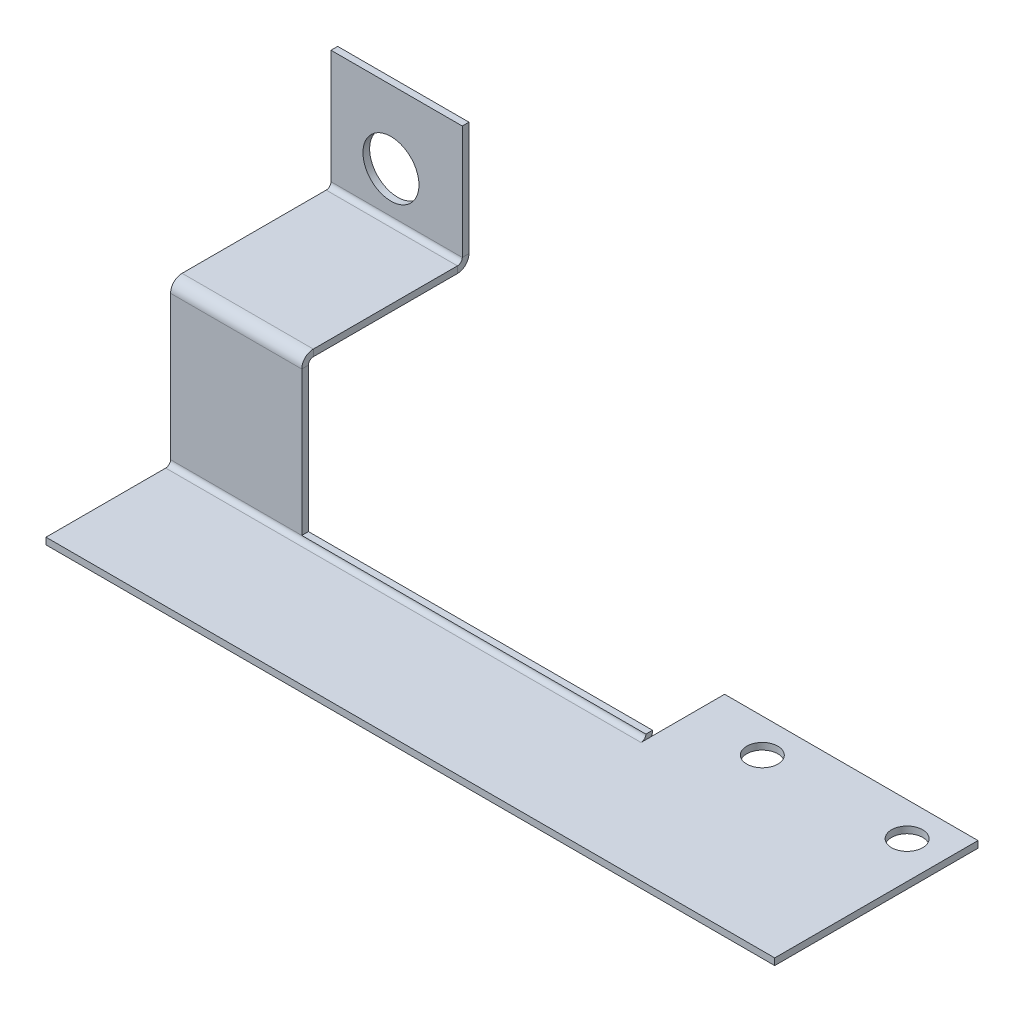
from build123d import *

# Parameters (mm, degrees)
SKETCH1_W                    = 110.7186
SKETCH1_H                    = 19.939
BASE_FLANGE1_DEPTH           = 1.016
EDGE_FLANGE1_STRIP_W         = 5.5372
EDGE_FLANGE1_STRIP_H         = 1.016
EDGE_FLANGE1_STRIP_CUT_DEPTH = 110.7186
EDGE_FLANGE1_DEPTH           = 110.7186
CUT_EXTRUDE1_REACH           = 116.94
SKETCH9_W                    = 90.7796
SKETCH9_H                    = 23.6474
EDGE_FLANGE2_STRIP_W         = 5.5372
EDGE_FLANGE2_STRIP_H         = 1.016
EDGE_FLANGE2_STRIP_CUT_DEPTH = 19.939
EDGE_FLANGE2_DEPTH           = 19.939
EDGE_FLANGE3_STRIP_W         = 5.5372
EDGE_FLANGE3_STRIP_H         = 1.016
EDGE_FLANGE3_STRIP_CUT_DEPTH = 19.939
EDGE_FLANGE3_DEPTH           = 19.939
CUT_EXTRUDE2_DEPTH           = 2.54
CUT_EXTRUDE2_DEPTH_BACK      = 2.54
SKETCH17_W                   = 38.49878
SKETCH17_H                   = 1.7526
SKETCH16_W                   = 38.49878
SKETCH16_H                   = 12.7
TAB2_DEPTH                   = 1.016
CUT_EXTRUDE3_REACH           = 128.228
SKETCH20_R                   = 4.2545
CUT_EXTRUDE4_REACH           = 128.58
SKETCH21_R                   = 2.36295848


# Sheet-metal steps are written as plain solids
with BuildPart() as part:
    # Sketch1 → Base-Flange1 (new body)
    with BuildSketch(Plane(origin=(0, 0, 0), x_dir=(1, 0, 0), z_dir=(0, 1, 0))):
        with Locations((-55.3593, 9.9695)):
            Rectangle(SKETCH1_W, SKETCH1_H)
    extrude(amount=-BASE_FLANGE1_DEPTH)

    # Edge-Flange1 strip (across the edge) → Edge-Flange1 strip cut (cut)
    with BuildSketch(Plane(origin=(0, 0, -19.939), x_dir=(0, 0, 1), z_dir=(-1, 0, 0))):
        with Locations((-1.016, -0.508)):
            Rectangle(EDGE_FLANGE1_STRIP_W, EDGE_FLANGE1_STRIP_H)
    extrude(amount=EDGE_FLANGE1_STRIP_CUT_DEPTH, mode=Mode.SUBTRACT)

    # Edge-Flange1 section (across the edge) → Edge-Flange1 (add)
    with BuildSketch(Plane(origin=(0, 0, -19.939), x_dir=(0, 0, 1), z_dir=(-1, 0, 0))):
        with BuildLine():
            Line((0, 0.7366), (0, 24.384))
            Line((0, 24.384), (1.016, 24.384))
            Line((1.016, 24.384), (1.016, 0.7366))
            ThreePointArc((1.016, 0.7366), (1.231745145, 0.215745145), (1.7526, 0))
            Line((1.7526, 0), (1.7526, -1.016))
            ThreePointArc((1.7526, -1.016), (0.513324655, -0.502675345), (0, 0.7366))
        make_face()
    extrude(amount=EDGE_FLANGE1_DEPTH)

    # Sketch9 → Cut-Extrude1 (cut, up to next)
    with BuildSketch(Plane.XY.offset(-18.923), mode=Mode.PRIVATE) as cut_extrude1_sk1:
        with Locations((-45.3898, 12.5603)):
            Rectangle(SKETCH9_W, SKETCH9_H)
    cut_extrude1_tool1 = extrude(cut_extrude1_sk1.sketch, amount=-CUT_EXTRUDE1_REACH, mode=Mode.PRIVATE) & part.part
    add(cut_extrude1_tool1.solids().sort_by_distance((-45.3898, 12.5603, -18.923))[0], mode=Mode.SUBTRACT)

    # Edge-Flange2 strip (across the edge) → Edge-Flange2 strip cut (cut)
    with BuildSketch(Plane(origin=(-110.7186, 24.384, -19.939), x_dir=(0, -1, 0), z_dir=(1, 0, 0))):
        with Locations((-1.016, -0.508)):
            Rectangle(EDGE_FLANGE2_STRIP_W, EDGE_FLANGE2_STRIP_H)
    extrude(amount=EDGE_FLANGE2_STRIP_CUT_DEPTH, mode=Mode.SUBTRACT)

    # Edge-Flange2 section (across the edge) → Edge-Flange2 (add)
    with BuildSketch(Plane(origin=(-110.7186, 24.384, -19.939), x_dir=(0, -1, 0), z_dir=(1, 0, 0))):
        with BuildLine():
            Line((0, 0.7366), (0, 24.384))
            Line((0, 24.384), (1.016, 24.384))
            Line((1.016, 24.384), (1.016, 0.7366))
            ThreePointArc((1.016, 0.7366), (1.231745145, 0.215745145), (1.7526, 0))
            Line((1.7526, 0), (1.7526, -1.016))
            ThreePointArc((1.7526, -1.016), (0.513324655, -0.502675345), (0, 0.7366))
        make_face()
    extrude(amount=EDGE_FLANGE2_DEPTH)

    # Edge-Flange3 strip (across the edge) → Edge-Flange3 strip cut (cut)
    with BuildSketch(Plane(origin=(-90.7796, 24.384, -44.323), x_dir=(0, 0, 1), z_dir=(-1, 0, 0))):
        with Locations((-1.016, -0.508)):
            Rectangle(EDGE_FLANGE3_STRIP_W, EDGE_FLANGE3_STRIP_H)
    extrude(amount=EDGE_FLANGE3_STRIP_CUT_DEPTH, mode=Mode.SUBTRACT)

    # Edge-Flange3 section (across the edge) → Edge-Flange3 (add)
    with BuildSketch(Plane(origin=(-90.7796, 24.384, -44.323), x_dir=(0, 0, 1), z_dir=(-1, 0, 0))):
        with BuildLine():
            Line((0, 0.7366), (0, 18.034))
            Line((0, 18.034), (1.016, 18.034))
            Line((1.016, 18.034), (1.016, 0.7366))
            ThreePointArc((1.016, 0.7366), (1.231745145, 0.215745145), (1.7526, 0))
            Line((1.7526, 0), (1.7526, -1.016))
            ThreePointArc((1.7526, -1.016), (0.513324655, -0.502675345), (0, 0.7366))
        make_face()
    extrude(amount=EDGE_FLANGE3_DEPTH)

    # Sketch17 → Cut-Extrude2 (cut, two sides: drawn at the far end of the back side and taken through both)
    with BuildSketch(Plane(origin=(0, 0, 0), x_dir=(1, 0, 0), z_dir=(0, 1, 0)).offset(-CUT_EXTRUDE2_DEPTH_BACK)):
        with Locations((-19.24939, 19.0627)):
            Rectangle(SKETCH17_W, SKETCH17_H)
    extrude(amount=CUT_EXTRUDE2_DEPTH + CUT_EXTRUDE2_DEPTH_BACK, mode=Mode.SUBTRACT)

    # Sketch16 → Tab2 (add)
    with BuildSketch(Plane(origin=(0, 0, 0), x_dir=(1, 0, 0), z_dir=(0, 1, 0))):
        with Locations((-19.24939, 24.5364)):
            Rectangle(SKETCH16_W, SKETCH16_H)
    extrude(amount=-TAB2_DEPTH)

    # Sketch20 → Cut-Extrude3 (cut, up to next)
    with BuildSketch(Plane.XY.offset(-43.307), mode=Mode.PRIVATE) as cut_extrude3_sk1:
        with Locations((-101.6161, 31.368930224)):
            Circle(SKETCH20_R)
    cut_extrude3_tool1 = extrude(cut_extrude3_sk1.sketch, amount=-CUT_EXTRUDE3_REACH, mode=Mode.PRIVATE) & part.part
    add(cut_extrude3_tool1.solids().sort_by_distance((-101.6161, 31.36893, -43.307))[0], mode=Mode.SUBTRACT)

    # Sketch21 → Cut-Extrude4 (cut, up to next)
    with BuildSketch(Plane(origin=(0, 0, 0), x_dir=(1, 0, 0), z_dir=(0, 1, 0)), mode=Mode.PRIVATE) as cut_extrude4_sk1:
        with Locations(Location((-27.6261, 25.7429, 0), (0, 0, 270))):
            Circle(SKETCH21_R)
    cut_extrude4_tool1 = extrude(cut_extrude4_sk1.sketch, amount=-CUT_EXTRUDE4_REACH, mode=Mode.PRIVATE) & part.part
    # Sketch21 → Cut-Extrude4 (cut, up to next)
    with BuildSketch(Plane(origin=(0, 0, 0), x_dir=(1, 0, 0), z_dir=(0, 1, 0)), mode=Mode.PRIVATE) as cut_extrude4_sk2:
        with Locations(Location((-5.6261, 25.7429, 0), (0, 0, 270))):
            Circle(SKETCH21_R)
    cut_extrude4_tool2 = extrude(cut_extrude4_sk2.sketch, amount=-CUT_EXTRUDE4_REACH, mode=Mode.PRIVATE) & part.part
    add(cut_extrude4_tool1.solids().sort_by_distance((-27.6261, 0, -25.7429))[0], mode=Mode.SUBTRACT)
    add(cut_extrude4_tool2.solids().sort_by_distance((-5.6261, 0, -25.7429))[0], mode=Mode.SUBTRACT)


solid = part.part
